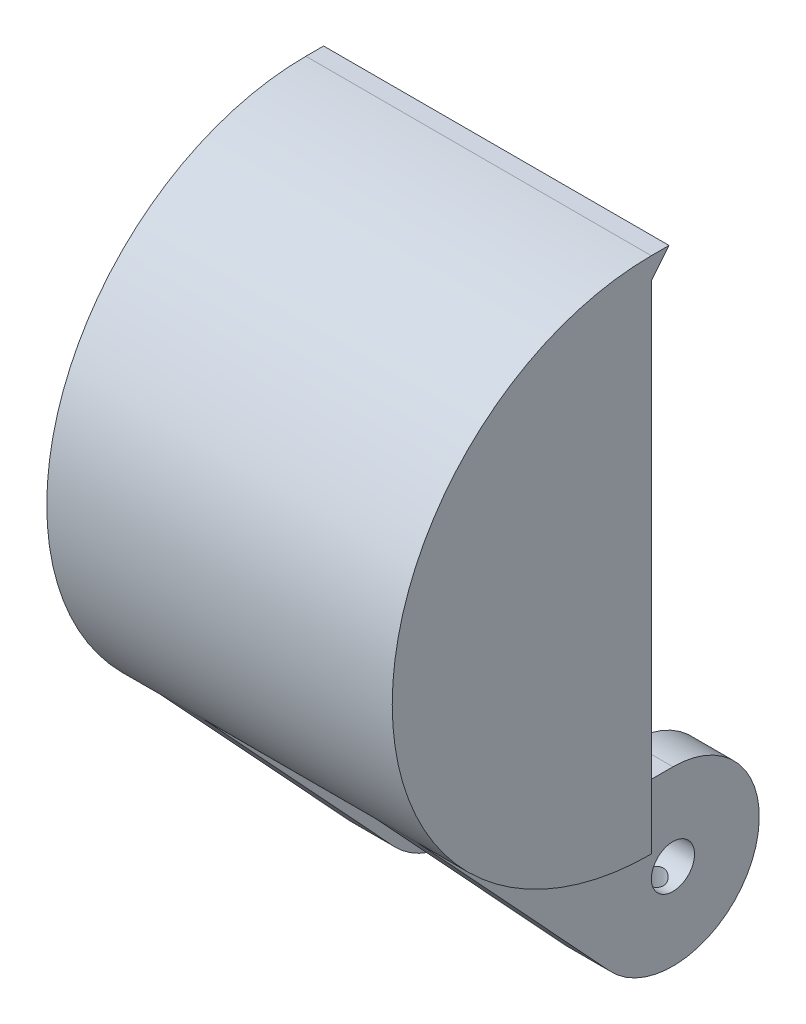
from build123d import *

# Parameters (mm, degrees)
BOSS_EXTRUDE1_DEPTH                 = 25.4
SHELL1_T                            = -3.175
SKETCH4_R                           = 12.7
BOSS_EXTRUDE3_DEPTH                 = 19.05
BOSS_EXTRUDE4_DEPTH                 = 19.05
SKETCH6_R                           = 12.7
CUT_EXTRUDE2_DEPTH                  = 12.7
CUT_EXTRUDE3_START                  = 12.7
SKETCH6_2_R                         = 12.7
CUT_EXTRUDE3_DEPTH                  = 12.7
CUT_EXTRUDE4_REACH                  = 98.093
SKETCH7_R                           = 3.175
BOSS_EXTRUDE5_REACH                 = 98.093
CUT_EXTRUDE5_DEPTH                  = 12.7
BOSS_EXTRUDE6_DEPTH                 = 25.4
FILLET2_R                           = 12.7
CUT_EXTRUDE6_REACH                  = 109.812
CUT_EXTRUDE6_END_RADIUS             = 3.175
SKETCH12_R                          = 1.7526
CUT_EXTRUDE6_DIRECTION_2_REACH      = 109.812
CUT_EXTRUDE6_DIRECTION_2_END_RADIUS = 12.7


with BuildPart() as part:
    # Sketch2 → Boss-Extrude1 (new, symmetric)
    with BuildSketch(Plane(origin=(0, 0, 0), x_dir=(0, 0, -1), z_dir=(1, 0, 0))):
        with BuildLine():
            Line((0, 0), (0, 76.2))
            ThreePointArc((0, 76.2), (-38.1, 38.1), (0, 0))
        make_face()
    extrude(amount=BOSS_EXTRUDE1_DEPTH, both=True)

    # Shell1
    shell1_openings = [part.faces().sort_by_distance(p)[0] for p in [
        (0, 38.1, 0),
    ]]
    offset(amount=SHELL1_T, openings=shell1_openings)



with BuildPart() as body_2:
    # Sketch4 → Boss-Extrude3 (new, symmetric)
    with BuildSketch(Plane(origin=(0, 0, 0), x_dir=(0, 0, -1), z_dir=(1, 0, 0))):
        with Locations(Location((9.525, -9.525, 0), (0, 0, 180))):
            Circle(SKETCH4_R)
    extrude(amount=BOSS_EXTRUDE3_DEPTH, both=True)


with BuildPart() as part_1:
    add(part.part)

    add(body_2.part)  # Boss-Extrude4 merges body 2
    # Sketch5 → Boss-Extrude4 (add, symmetric)
    with BuildSketch(Plane(origin=(0, 0, 0), x_dir=(0, 0, -1), z_dir=(1, 0, 0))):
        with BuildLine():
            Line((0, 3.175), (0, 0))
            Line((0, 0), (1.124739587, 0))
            ThreePointArc((1.124739587, 0), (5.034871939, 2.354762203), (9.525, 3.175))
            Line((9.525, 3.175), (0, 3.175))
        make_face()
    extrude(amount=BOSS_EXTRUDE4_DEPTH, both=True)

    # Sketch6 → Cut-Extrude2 (cut)
    with BuildSketch(Plane(origin=(0, 0, 0), x_dir=(0, 0, -1), z_dir=(1, 0, 0))):
        with Locations((9.525, -9.525)):
            Circle(SKETCH6_R)
    extrude(amount=-CUT_EXTRUDE2_DEPTH, mode=Mode.SUBTRACT)

    # Sketch6<2> → Cut-Extrude3 (cut)
    with BuildSketch(Plane(origin=(0, 0, 0), x_dir=(0, 0, -1), z_dir=(1, 0, 0)).offset(CUT_EXTRUDE3_START)):
        with Locations((9.525, -9.525)):
            Circle(SKETCH6_2_R)
    extrude(amount=-CUT_EXTRUDE3_DEPTH, mode=Mode.SUBTRACT)

    # Cut-Extrude4: up to this face of the body (flat: up to its plane)
    cut_extrude4_end = Plane(part_1.part.faces().sort_by_distance((19.05, -9.258016607, -9.360446087))[0])
    # Sketch7 → Cut-Extrude4 (cut, up to the picked face)
    with BuildSketch(Plane.ZY.offset(19.05), mode=Mode.PRIVATE) as cut_extrude4_sk1:
        with Locations(Location((-9.525, -9.525, 0), (0, 0, 180))):
            Circle(SKETCH7_R)
    cut_extrude4_tool1 = split(extrude(cut_extrude4_sk1.sketch, amount=-CUT_EXTRUDE4_REACH, mode=Mode.PRIVATE), bisect_by=cut_extrude4_end, keep=Keep.BOTH, mode=Mode.PRIVATE)
    add(cut_extrude4_tool1.solids().sort_by(Axis((-19.05, -9.525, -9.525), (1, 0, 0)))[0], mode=Mode.SUBTRACT)

    # Boss-Extrude5: up to this face of the body (flat: up to its plane)
    boss_extrude5_end = Plane(part_1.part.faces().sort_by_distance((-19.05, 2.815789755, -4.7625))[0])
    # Sketch8 → Boss-Extrude5 (add, up to the picked face)
    with BuildSketch(Plane(origin=(19.05, 0, 0), x_dir=(0, 0, -1), z_dir=(1, 0, 0)), mode=Mode.PRIVATE) as boss_extrude5_sk1:
        with BuildLine():
            Line((-27.936104056, 12.192779189), (0.212965315, -18.16074027))
            Line((0.212965315, -18.16074027), (5.034871939, -21.404762203))
            Line((5.034871939, -21.404762203), (1.124739587, 0))
            Line((1.124739587, 0), (0, 3.175))
            ThreePointArc((0, 3.175), (-13.704863106, 5.9762961), (-25.211222013, 13.9308066))
            Line((-25.211222013, 13.9308066), (-27.936104056, 12.192779189))
        make_face()
    boss_extrude5_tool1 = split(extrude(boss_extrude5_sk1.sketch, amount=-BOSS_EXTRUDE5_REACH, mode=Mode.PRIVATE), bisect_by=boss_extrude5_end, keep=Keep.BOTH, mode=Mode.PRIVATE)
    add(boss_extrude5_tool1.solids().sort_by(Axis((19.05, -2.840531, 7.724646), (-1, 0, 0)))[0])

    # Sketch9 → Cut-Extrude5 (cut, symmetric)
    with BuildSketch(Plane(origin=(0, 0, 0), x_dir=(0, 0, -1), z_dir=(1, 0, 0))):
        with BuildLine():
            Line((0, 3.175), (0, 0))
            ThreePointArc((0, 0), (-15.240486985, 3.180985746), (-27.936104056, 12.192779189))
            Line((-27.936104056, 12.192779189), (0.212965315, -18.16074027))
            ThreePointArc((0.212965315, -18.16074027), (21.164671418, -14.605162328), (9.525, 3.175))
            Line((9.525, 3.175), (0, 3.175))
        make_face()
    extrude(amount=CUT_EXTRUDE5_DEPTH, both=True, mode=Mode.SUBTRACT)

    # Sketch11 → Boss-Extrude6 (add, symmetric)
    with BuildSketch(Plane(origin=(0, 0, 0), x_dir=(0, 0, -1), z_dir=(1, 0, 0))):
        Polygon((2.609832197, 76.2), (0, 76.2), (0, 73.025), align=None)
    extrude(amount=BOSS_EXTRUDE6_DEPTH, both=True)

    # Fillet2
    # the kernel refuses this fillet: 12.7 mm, written as the material it adds along each edge
    with BuildSketch(Plane(origin=(-22.225, 38.1, 0), x_dir=(0, 1, 0), z_dir=(0, 0, -1))) as fillet2_piece_1:
        with BuildLine():
            CenterArc((34.925 - FILLET2_R, FILLET2_R), FILLET2_R, 270, 90)
            Line((34.925 - FILLET2_R, 0), (34.925, 0))
            Line((34.925, 0), (34.925, FILLET2_R))
        make_face()
    revolve(axis=Axis((-22.225, 38.1, 0), (1, 0, 0)), revolution_arc=180)
    with BuildSketch(Plane(origin=(22.225, 38.1, 0), x_dir=(0, 1, 0), z_dir=(0, 0, -1))) as fillet2_piece_2:
        with BuildLine():
            CenterArc((34.925 - FILLET2_R, -FILLET2_R), FILLET2_R, 0, 90)
            Line((34.925 - FILLET2_R, 0), (34.925, 0))
            Line((34.925, 0), (34.925, -FILLET2_R))
        make_face()
    revolve(axis=Axis((22.225, 38.1, 0), (1, 0, 0)), revolution_arc=180)

    # Cut-Extrude6: up to this cylinder (the profile starts outside it)
    cut_extrude6_end = Plane(origin=(0, -9.525, -9.525), z_dir=(-1, 0, 0)) * Cylinder(CUT_EXTRUDE6_END_RADIUS, 258.724, mode=Mode.PRIVATE)
    # Sketch12 → Cut-Extrude6 (cut, up to the surface)
    with BuildSketch(Plane(origin=(0, -21.404762203, 0), x_dir=(1, 0, 0), z_dir=(0, 1, 0)), mode=Mode.PRIVATE) as cut_extrude6_sk1:
        with Locations(Location((15.875, 9.525, 0), (0, 0, 90))):
            Circle(SKETCH12_R)
    cut_extrude6_tool1 = extrude(cut_extrude6_sk1.sketch, amount=CUT_EXTRUDE6_REACH, mode=Mode.PRIVATE) - cut_extrude6_end
    add(cut_extrude6_tool1.solids().sort_by_distance((15.875, -21.404762, -9.525))[0], mode=Mode.SUBTRACT)
    # Sketch12 → Cut-Extrude6 (cut, up to the surface)
    with BuildSketch(Plane(origin=(0, -21.404762203, 0), x_dir=(1, 0, 0), z_dir=(0, 1, 0)), mode=Mode.PRIVATE) as cut_extrude6_sk2:
        with Locations(Location((-15.875, 9.525, 0), (0, 0, 90))):
            Circle(SKETCH12_R)
    cut_extrude6_tool2 = extrude(cut_extrude6_sk2.sketch, amount=CUT_EXTRUDE6_REACH, mode=Mode.PRIVATE) - cut_extrude6_end
    add(cut_extrude6_tool2.solids().sort_by_distance((-15.875, -21.404762, -9.525))[0], mode=Mode.SUBTRACT)

    # Cut-Extrude6 direction 2: up to this cylinder (the profile starts inside it)
    cut_extrude6_direction_2_end = Plane(origin=(0, -9.525, -9.525), z_dir=(-1, 0, 0)) * Cylinder(CUT_EXTRUDE6_DIRECTION_2_END_RADIUS, 277.774, mode=Mode.PRIVATE)
    # Sketch12 → Cut-Extrude6 direction 2 (cut, up to the surface)
    with BuildSketch(Plane(origin=(0, -21.404762203, 0), x_dir=(1, 0, 0), z_dir=(0, 1, 0)), mode=Mode.PRIVATE) as cut_extrude6_direction_2_sk1:
        with Locations(Location((15.875, 9.525, 0), (0, 0, 90))):
            Circle(SKETCH12_R)
    cut_extrude6_direction_2_tool1 = extrude(cut_extrude6_direction_2_sk1.sketch, amount=-CUT_EXTRUDE6_DIRECTION_2_REACH, mode=Mode.PRIVATE) & cut_extrude6_direction_2_end
    add(cut_extrude6_direction_2_tool1.solids().sort_by_distance((15.875, -21.404762, -9.525))[0], mode=Mode.SUBTRACT)
    # Sketch12 → Cut-Extrude6 direction 2 (cut, up to the surface)
    with BuildSketch(Plane(origin=(0, -21.404762203, 0), x_dir=(1, 0, 0), z_dir=(0, 1, 0)), mode=Mode.PRIVATE) as cut_extrude6_direction_2_sk2:
        with Locations(Location((-15.875, 9.525, 0), (0, 0, 90))):
            Circle(SKETCH12_R)
    cut_extrude6_direction_2_tool2 = extrude(cut_extrude6_direction_2_sk2.sketch, amount=-CUT_EXTRUDE6_DIRECTION_2_REACH, mode=Mode.PRIVATE) & cut_extrude6_direction_2_end
    add(cut_extrude6_direction_2_tool2.solids().sort_by_distance((-15.875, -21.404762, -9.525))[0], mode=Mode.SUBTRACT)


solid = part_1.part
